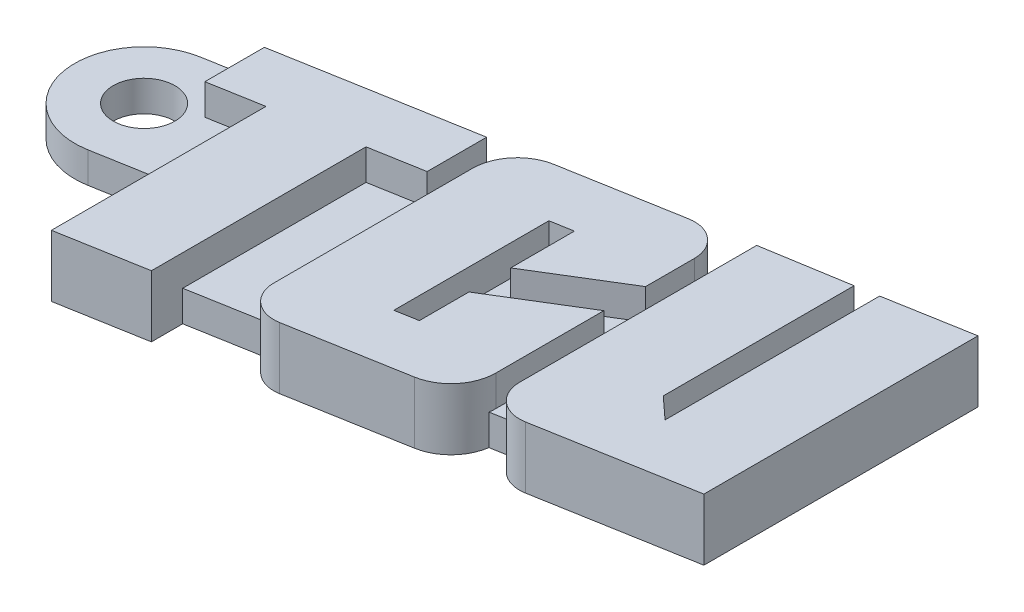
from build123d import *

# Parameters (mm, degrees)
BOSS_EXTRUDE1_DEPTH   = 2
BOSS_EXTRUDE1_2_DEPTH = 2
BOSS_EXTRUDE1_3_DEPTH = 2
BOSS_EXTRUDE3_DEPTH   = 2
SKETCH4_R             = 2
BOSS_EXTRUDE4_DEPTH   = 2


with BuildPart() as part:
    # Sketch1 → Boss-Extrude1 (new body)
    with BuildSketch(Plane(origin=(0, 0, 0), x_dir=(1, 0, 0), z_dir=(0, 1, 0))):
        Polygon((0, 17.788169004), (12.262548723, 19.950387196), (12.262548723, 16.087684348), (8.890347824, 15.493074345), (8.890347824, 1.567608189), (3.372200899, 0.594610003), (3.372200899, 14.520076159), (0, 13.925466156), align=None)
    extrude(amount=BOSS_EXTRUDE1_DEPTH)



with BuildPart() as body_2:
    # Sketch1 → Boss-Extrude1 2 (new body)
    with BuildSketch(Plane(origin=(0, 0, 0), x_dir=(1, 0, 0), z_dir=(0, 1, 0))):
        with BuildLine():
            Line((23.400776503, 21.914357271), (15.968729001, 20.603886774))
            ThreePointArc((15.968729001, 20.603886774), (14.237280721, 19.604234643), (13.553478391, 17.725503182))
            Line((13.553478391, 17.725503182), (13.553478391, 4.842353667))
            ThreePointArc((13.553478391, 4.842353667), (14.288585777, 3.265910791), (15.968729001, 2.815717771))
            Line((15.968729001, 2.815717771), (23.400776503, 4.126188267))
            ThreePointArc((23.400776503, 4.126188267), (25.132224783, 5.125840398), (25.816027113, 7.004571859))
            Line((25.816027113, 7.004571859), (25.816027113, 14.002032701))
            Line((25.816027113, 14.002032701), (20.389849304, 10.676866663))
            Line((20.389849304, 10.676866663), (20.389849304, 7.457983412))
            Line((20.389849304, 7.457983412), (18.979656201, 7.20932832))
            Line((18.979656201, 7.20932832), (18.979656201, 17.272091629))
            Line((18.979656201, 17.272091629), (20.389849304, 17.520746721))
            Line((20.389849304, 17.520746721), (20.389849304, 13.383761085))
            Line((20.389849304, 13.383761085), (25.816027113, 16.708927123))
            Line((25.816027113, 16.708927123), (25.816027113, 19.887721374))
            ThreePointArc((25.816027113, 19.887721374), (25.080919728, 21.46416425), (23.400776503, 21.914357271))
        make_face()
    extrude(amount=BOSS_EXTRUDE1_2_DEPTH)


with BuildPart() as body_3:
    # Sketch1 → Boss-Extrude1 3 (new body)
    with BuildSketch(Plane(origin=(0, 0, 0), x_dir=(1, 0, 0), z_dir=(0, 1, 0))):
        with BuildLine():
            Line((27.106956781, 22.63096242), (27.106956781, 7.23219759))
            ThreePointArc((27.106956781, 7.23219759), (27.842064167, 5.655754714), (29.522207392, 5.205561693))
            Line((29.522207392, 5.205561693), (39.369505504, 6.941906038))
            Line((39.369505504, 6.941906038), (39.369505504, 24.730075041))
            Line((39.369505504, 24.730075041), (33.943327694, 23.773293491))
            Line((33.943327694, 23.773293491), (33.943327694, 9.847827335))
            Line((33.943327694, 9.847827335), (32.533134591, 11.140031237))
            Line((32.533134591, 11.140031237), (32.533134591, 23.524638399))
            Line((32.533134591, 23.524638399), (27.106956781, 22.63096242))
        make_face()
    extrude(amount=BOSS_EXTRUDE1_3_DEPTH)


with BuildPart() as part_1:
    add(part.part)

    add(body_2.part)  # Boss-Extrude3 merges body 2

    add(body_3.part)  # Boss-Extrude3 merges body 3
    # Sketch3 → Boss-Extrude3 (add)
    with BuildSketch(Plane(origin=(0, 0, 0), x_dir=(1, 0, 0), z_dir=(0, 1, 0))):
        with BuildLine():
            Line((27.149077447, 6.817968079), (25.784639731, 6.577380896))
            ThreePointArc((25.784639731, 6.577380896), (24.988539038, 4.966826351), (23.400776503, 4.126188267))
            Line((23.400776503, 4.126188267), (15.968729001, 2.815717771))
            ThreePointArc((15.968729001, 2.815717771), (14.454849087, 3.140180815), (13.595599057, 4.428124156))
            Line((13.595599057, 4.428124156), (8.890347824, 3.598461413))
            Line((8.890347824, 3.598461413), (8.890347824, 1.567608189))
            Line((8.890347824, 1.567608189), (3.372200899, 0.594610003))
            Line((3.372200899, 0.594610003), (3.372200899, 14.520076159))
            Line((3.372200899, 14.520076159), (0, 13.925466156))
            Line((0, 13.925466156), (0, 17.788169004))
            Line((0, 17.788169004), (12.262548723, 19.950387196))
            Line((12.262548723, 19.950387196), (12.262548723, 17.919533972))
            Line((12.262548723, 17.919533972), (13.584865773, 18.152694145))
            ThreePointArc((13.584865773, 18.152694145), (14.380966466, 19.763248691), (15.968729001, 20.603886774))
            Line((15.968729001, 20.603886774), (23.400776503, 21.914357271))
            ThreePointArc((23.400776503, 21.914357271), (24.914656418, 21.589894226), (25.773906448, 20.301950885))
            Line((25.773906448, 20.301950885), (27.106956781, 20.537003625))
            Line((27.106956781, 20.537003625), (27.106956781, 22.63096242))
            Line((27.106956781, 22.63096242), (32.533134591, 23.524638399))
            Line((32.533134591, 23.524638399), (32.533134591, 21.493785175))
            Line((32.533134591, 21.493785175), (33.943327694, 21.742440268))
            Line((33.943327694, 21.742440268), (33.943327694, 23.773293491))
            Line((33.943327694, 23.773293491), (39.369505504, 24.730075041))
            Line((39.369505504, 24.730075041), (39.369505504, 6.941906038))
            Line((39.369505504, 6.941906038), (29.522207392, 5.205561693))
            ThreePointArc((29.522207392, 5.205561693), (28.008327477, 5.530024738), (27.149077447, 6.817968079))
        make_face()
    extrude(amount=-BOSS_EXTRUDE3_DEPTH)

    # Sketch4 → Boss-Extrude4 (add)
    with BuildSketch(Plane(origin=(0, 0, 0), x_dir=(1, 0, 0), z_dir=(0, 1, 0))):
        with BuildLine():
            Line((3.372200899, 9.2439395), (-1.971546264, 8.301692697))
            ThreePointArc((-1.971546264, 8.301692697), (-7.184597952, 11.951910786), (-3.534379863, 17.164962474))
            Line((-3.534379863, 17.164962474), (3.372200899, 18.382779007))
            Line((3.372200899, 18.382779007), (3.372200899, 9.2439395))
        make_face()
        with Locations((-2.752963063, 12.733327585)):
            Circle(SKETCH4_R, mode=Mode.SUBTRACT)
    extrude(amount=-BOSS_EXTRUDE4_DEPTH)


solid = part_1.part
